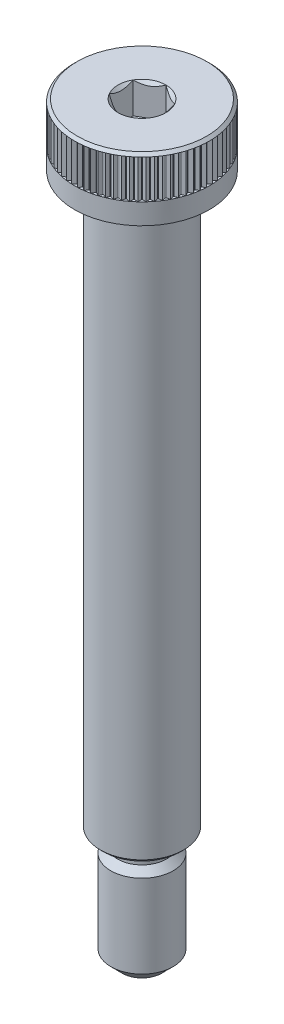
from build123d import *

# Parameters (mm, degrees)
SKETCH1_R          = 6.5
EXTRUDE1_DEPTH     = 6
CUT_EXTRUDE1_DEPTH = 3
SKETCH4_R          = 4
EXTRUDE2_DEPTH     = 55
SKETCH5_R          = 3
EXTRUDE3_DEPTH     = 11
CHAMFER1_SIZE      = 1.1
FILLET1_R          = 0.5
CHAMFER3_SIZE      = 0.333333333
CUT_EXTRUDE3_DEPTH = 3.73490355
CHAMFER2_SIZE      = 0.26509645
CIRPATTERN2_COUNT  = 72


with BuildPart() as part:
    # Sketch1 → Extrude1 (new body)
    with BuildSketch(Plane(origin=(0, 0, 0), x_dir=(1, 0, 0), z_dir=(0, 1, 0))):
        with Locations(Location((0, 0, 0), (0, 0, 270))):
            Circle(SKETCH1_R)
    extrude(amount=EXTRUDE1_DEPTH)

    # Sketch2 → Cut-Extrude1 (cut)
    with BuildSketch(Plane(origin=(0, 6, 0), x_dir=(-1, 0, 0), z_dir=(0, 1, 0))):
        Polygon((0, -2.309401077), (2, -1.154700538), (2, 1.154700538), (0, 2.309401077), (-2, 1.154700538), (-2, -1.154700538), align=None)
    extrude(amount=-CUT_EXTRUDE1_DEPTH, mode=Mode.SUBTRACT)

    # Sketch4 → Extrude2 (add)
    with BuildSketch(Plane.XZ):
        with Locations(Location((0, 0, 0), (0, 0, 90))):
            Circle(SKETCH4_R)
    extrude(amount=EXTRUDE2_DEPTH)

    # Sketch5 → Extrude3 (add)
    with BuildSketch(Plane.XZ.offset(55)):
        with Locations(Location((0, 0, 0), (0, 0, 270))):
            Circle(SKETCH5_R)
    extrude(amount=EXTRUDE3_DEPTH)

    # Chamfer1
    chamfer1_edges = [part.edges().sort_by_distance(p)[0] for p in [
        (0, -66, 3),
    ]]
    chamfer(chamfer1_edges, length=CHAMFER1_SIZE)

    # Sketch17 → Cut-Revolve8 (revolve, cut)
    with BuildSketch(Plane.XY, mode=Mode.PRIVATE) as cut_revolve8_sk:
        Polygon((3, -55), (2.350480947, -55), (2.350480947, -56.25), (3, -56.899519053), align=None)
    revolve(cut_revolve8_sk.sketch.rotate(Axis((0, -55, 0), (0, 1, 0)), 90), axis=Axis((0, -55, 0), (0, 1, 0)), mode=Mode.SUBTRACT)

    # Fillet1
    fillet1_edges = [part.edges().sort_by_distance(p)[0] for p in [
        (0, -55, 2.350480947),
    ]]
    fillet(fillet1_edges, radius=FILLET1_R)

    # Chamfer3
    chamfer3_edges = [part.edges().sort_by_distance(p)[0] for p in [
        (0, -55, -4),
    ]]
    chamfer(chamfer3_edges, length=CHAMFER3_SIZE)

    # Sketch10 → Cut-Extrude3 (cut)
    with BuildSketch(Plane(origin=(0, 2, 0), x_dir=(-1, 0, 0), z_dir=(0, 1, 0))):
        with BuildLine():
            Line((-6.49381344, -0.283526018), (-6.58898007, -0.287681083))
            Line((-6.58898007, -0.287681083), (-6.58898007, 0.287681083))
            Line((-6.58898007, 0.287681083), (-6.49381344, 0.283526018))
            Line((-6.49381344, 0.283526018), (-6.252309781, 0.042022359))
            ThreePointArc((-6.252309781, 0.042022359), (-6.23490355, 0), (-6.252309781, -0.042022359))
            Line((-6.252309781, -0.042022359), (-6.49381344, -0.283526018))
        make_face()
    cut_extrude3 = extrude(amount=CUT_EXTRUDE3_DEPTH, mode=Mode.SUBTRACT)

    # Chamfer2
    chamfer2_edges = [part.edges().sort_by_distance(p)[0] for p in [
        (0, 6, -6.5),
    ]]
    chamfer(chamfer2_edges, length=CHAMFER2_SIZE - 0.0001)  # a hair under: the kernel refuses the full size

    # CirPattern2: Cut-Extrude3 ×72 about axis
    cirpattern2_axis = Axis((0, 0, 0), (0, 1, 0))
    for i in range(1, CIRPATTERN2_COUNT):
        add(cut_extrude3.rotate(cirpattern2_axis, i * 360 / CIRPATTERN2_COUNT), mode=Mode.SUBTRACT)

    # Extrude4 cone 1 section (through the dimple's axis) → Extrude4 (revolve, cut)
    with BuildSketch(Plane(origin=(0, 6, 0), x_dir=(0, 0, 1), z_dir=(1, 0, 0))):
        Polygon((0, 0), (2.309401077, 0), (0, 2.309401077), align=None)
    revolve(axis=Axis((0, 6, 0), (0, -1, 0)), mode=Mode.SUBTRACT)


solid = part.part
